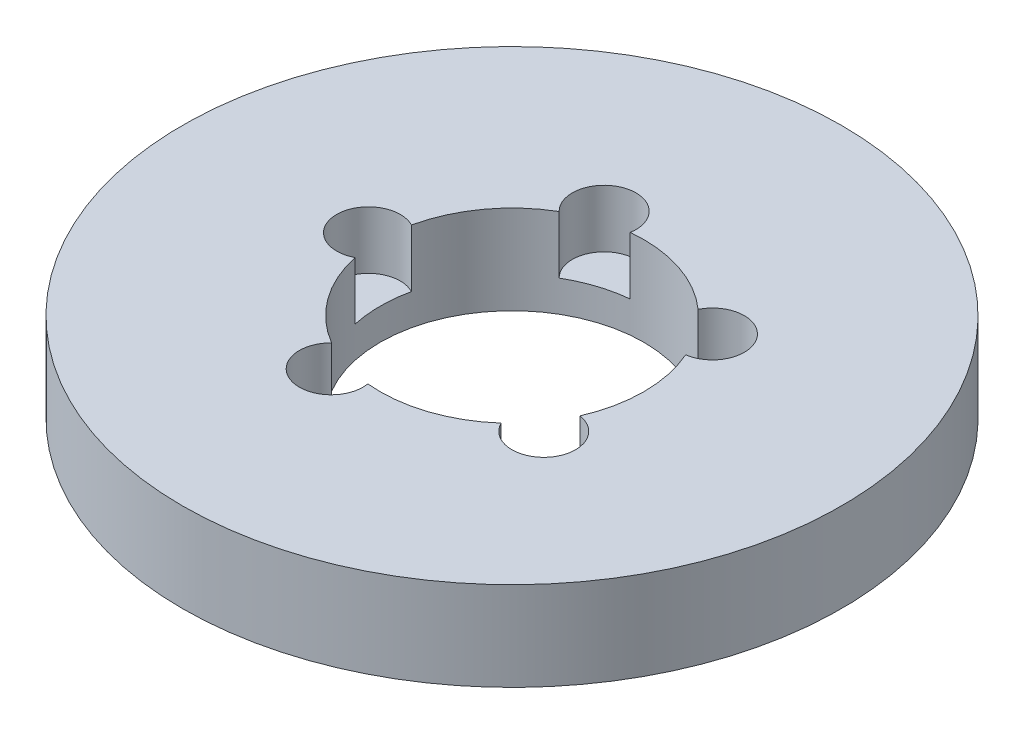
from build123d import *

# Parameters (mm, degrees)
SKETCH1_R           = 100
BOSS_EXTRUDE1_DEPTH = 27
SKETCH2_R           = 40
CUT_EXTRUDE1_DEPTH  = 144.975692393
SKETCH3_R           = 9.659131225
CUT_EXTRUDE2_DEPTH  = 17.496056464
CIRPATTERN1_COUNT   = 5


with BuildPart() as part:
    # Sketch1 → Boss-Extrude1 (new body)
    with BuildSketch(Plane(origin=(0, 0, 0), x_dir=(1, 0, 0), z_dir=(0, 1, 0))):
        Circle(SKETCH1_R)
    extrude(amount=BOSS_EXTRUDE1_DEPTH)

    # Sketch2 → Cut-Extrude1 (cut, through all)
    with BuildSketch(Plane(origin=(0, 0, 0), x_dir=(1, 0, 0), z_dir=(0, 1, 0))):
        Circle(SKETCH2_R)
    extrude(amount=CUT_EXTRUDE1_DEPTH, mode=Mode.SUBTRACT)

    # Sketch3 → Cut-Extrude2 (cut)
    with BuildSketch(Plane(origin=(0, 27, 0), x_dir=(1, 0, 0), z_dir=(0, 1, 0))):
        with Locations((-43.546411517, 0)):
            Circle(SKETCH3_R)
    cut_extrude2 = extrude(amount=-CUT_EXTRUDE2_DEPTH, mode=Mode.SUBTRACT)

    # CirPattern1: Cut-Extrude2 ×5 about axis
    cirpattern1_axis = Axis((0, 0, 0), (0, 1, 0))
    for i in range(1, CIRPATTERN1_COUNT):
        add(cut_extrude2.rotate(cirpattern1_axis, i * 360 / CIRPATTERN1_COUNT), mode=Mode.SUBTRACT)


solid = part.part
